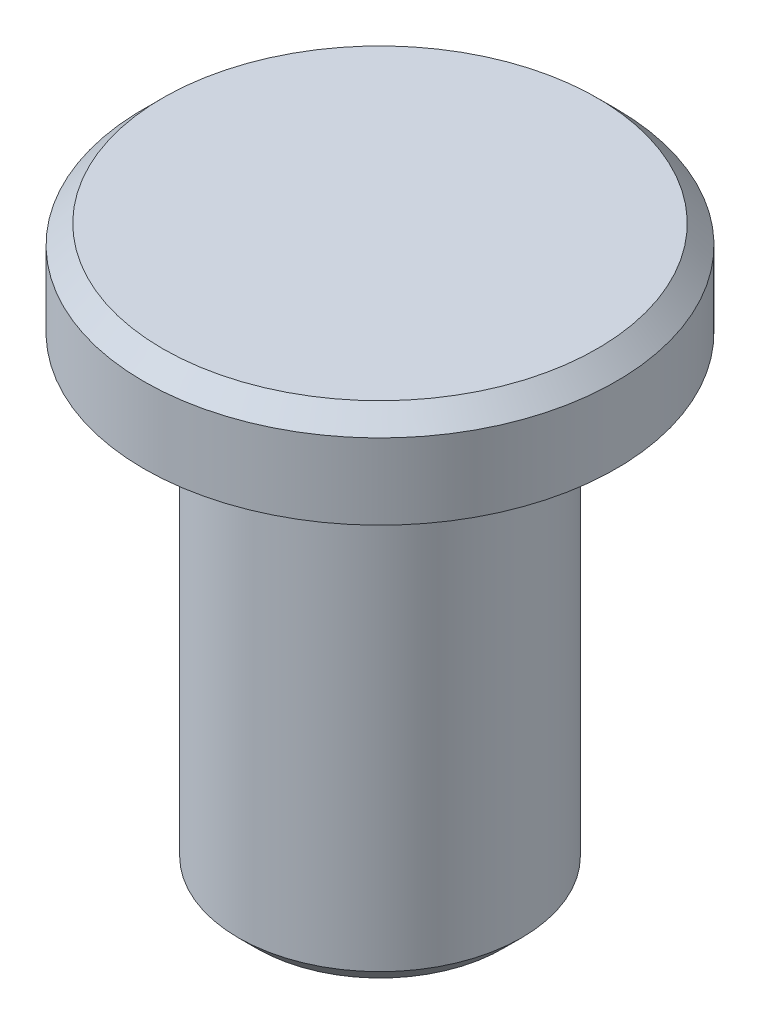
from build123d import *

# Parameters (mm, degrees)
SKETCH1_R           = 1.5
BOSS_EXTRUDE1_DEPTH = 5
SKETCH2_R           = 2.5
BOSS_EXTRUDE2_DEPTH = 1
CHAMFER1_SIZE       = 0.2
CHAMFER2_SIZE       = 0.2


with BuildPart() as part:
    # Sketch1 → Boss-Extrude1 (new body)
    with BuildSketch(Plane(origin=(0, 0, 0), x_dir=(1, 0, 0), z_dir=(0, 1, 0))):
        Circle(SKETCH1_R)
    extrude(amount=BOSS_EXTRUDE1_DEPTH)

    # Sketch2 → Boss-Extrude2 (add)
    with BuildSketch(Plane(origin=(0, 5, 0), x_dir=(1, 0, 0), z_dir=(0, 1, 0))):
        Circle(SKETCH2_R)
    extrude(amount=BOSS_EXTRUDE2_DEPTH)

    # Chamfer1
    chamfer1_edges = [part.edges().sort_by_distance(p)[0] for p in [
        (-2.5, 6, 0),
    ]]
    chamfer(chamfer1_edges, length=CHAMFER1_SIZE)

    # Chamfer2
    chamfer2_edges = [part.edges().sort_by_distance(p)[0] for p in [
        (-1.5, 0, 0),
    ]]
    chamfer(chamfer2_edges, length=CHAMFER2_SIZE)


solid = part.part
